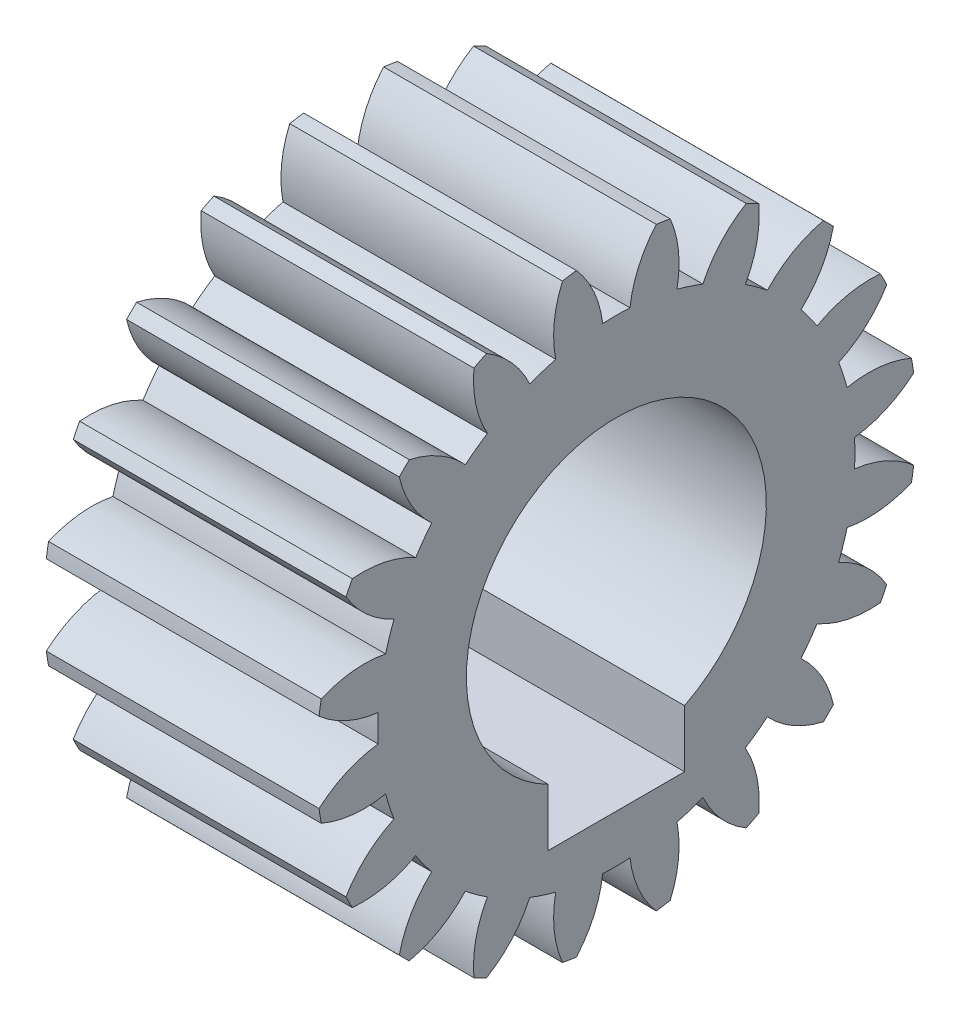
from build123d import *

# Parameters (mm, degrees)
BASPROSKE_W             = 5
BASPROSKE_H             = 5.5
TOOTHCUT_DEPTH          = 10.246621004
TEETHCUTS_COUNT         = 20
TEETHCUTS_ANGLE         = 342
BORSKE_R                = 0.5
BORE_DEPTH              = 50.0000508
CUT_EXTRUDE1_DEPTH      = 10.188413972
CUT_EXTRUDE1_DEPTH_BACK = 10.188413972


with BuildPart() as part:
    # BasProSke → Base-Revolve (revolve)
    with BuildSketch(Plane(origin=(0, 0, 0), x_dir=(1, 0, 0), z_dir=(0, 1, 0))):
        with Locations((2.5, 2.75)):
            Rectangle(BASPROSKE_W, BASPROSKE_H)
    revolve(axis=Axis((-10, 0, 0), (1, 0, 0)))

    # TooCutSke → ToothCut (cut, through all)
    with BuildSketch(Plane(origin=(0, 0, 0), x_dir=(0, 0, -1), z_dir=(1, 0, 0))):
        with BuildLine():
            ThreePointArc((0.249903181, 4.366855207), (0, 4.374), (-0.249903181, 4.366855207))
            ThreePointArc((-0.249903181, 4.366855207), (-0.415207844, 4.95951031), (-0.752843848, 5.473871692))
            ThreePointArc((-0.752843848, 5.473871692), (0, 5.5254), (0.752843848, 5.473871692))
            ThreePointArc((0.752843848, 5.473871692), (0.415207844, 4.95951031), (0.249903181, 4.366855207))
        make_face()
    toothcut = extrude(amount=TOOTHCUT_DEPTH, mode=Mode.SUBTRACT)

    # TeethCuts: ToothCut ×20 about axis
    teethcuts_axis = Axis((-10, 0, 0), (1, 0, 0))
    for i in range(1, TEETHCUTS_COUNT):
        add(toothcut.rotate(teethcuts_axis, i * TEETHCUTS_ANGLE / (TEETHCUTS_COUNT - 1)), mode=Mode.SUBTRACT)

    # BorSke → Bore (cut, symmetric)
    with BuildSketch(Plane(origin=(0, 0, 0), x_dir=(0, 0, -1), z_dir=(1, 0, 0))):
        Circle(BORSKE_R)
    extrude(amount=BORE_DEPTH, both=True, mode=Mode.SUBTRACT)

    # Sketch1 → Cut-Extrude1 (cut, two sides: drawn at the far end of the back side and taken through both)
    with BuildSketch(Plane(origin=(5, 0, 0), x_dir=(0, 0, -1), z_dir=(1, 0, 0)).offset(-CUT_EXTRUDE1_DEPTH_BACK)):
        with BuildLine():
            ThreePointArc((1.25, -2.449489743), (0, 2.75), (-1.25, -2.449489743))
            Line((-1.25, -2.449489743), (-1.25, -3.5))
            Line((-1.25, -3.5), (1.25, -3.5))
            Line((1.25, -3.5), (1.25, -2.449489743))
        make_face()
    extrude(amount=CUT_EXTRUDE1_DEPTH + CUT_EXTRUDE1_DEPTH_BACK, mode=Mode.SUBTRACT)


solid = part.part
